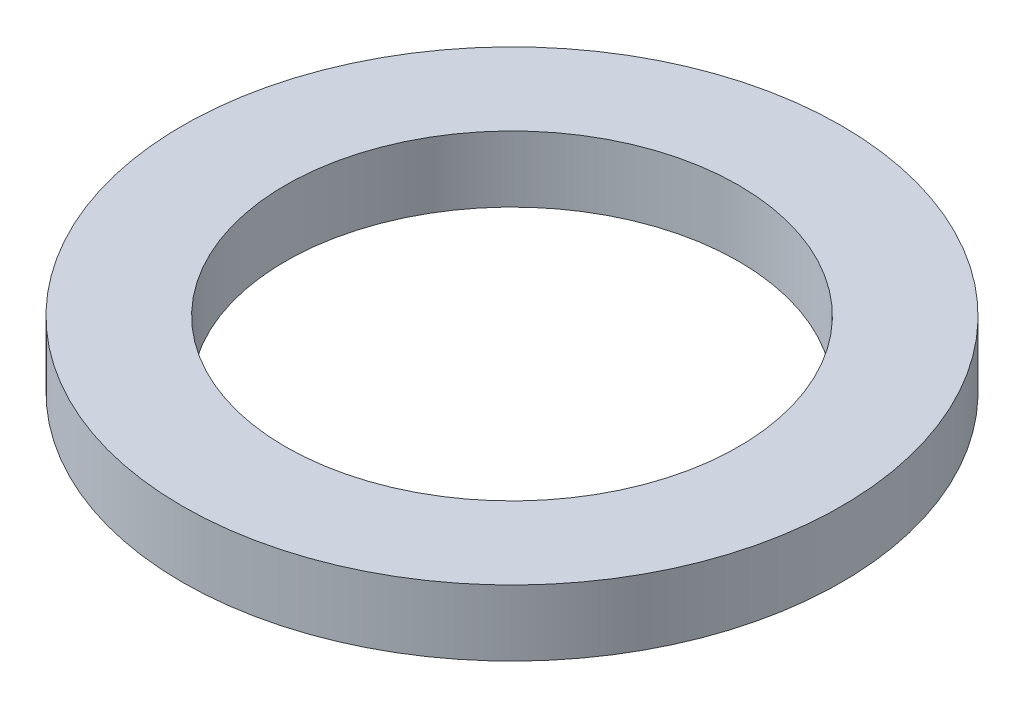
from build123d import *

# Parameters (mm, degrees)
SKETCH1_R           = 40
BOSS_EXTRUDE1_DEPTH = 8
SKETCH2_R           = 27.5
CUT_EXTRUDE1_DEPTH  = 58.131427428


with BuildPart() as part:
    # Sketch1 → Boss-Extrude1 (new body)
    with BuildSketch(Plane(origin=(0, 0, 0), x_dir=(1, 0, 0), z_dir=(0, 1, 0))):
        Circle(SKETCH1_R)
    extrude(amount=BOSS_EXTRUDE1_DEPTH)

    # Sketch2 → Cut-Extrude1 (cut, through all)
    with BuildSketch(Plane(origin=(0, 0, 0), x_dir=(1, 0, 0), z_dir=(0, 1, 0))):
        Circle(SKETCH2_R)
    extrude(amount=CUT_EXTRUDE1_DEPTH, mode=Mode.SUBTRACT)


solid = part.part
